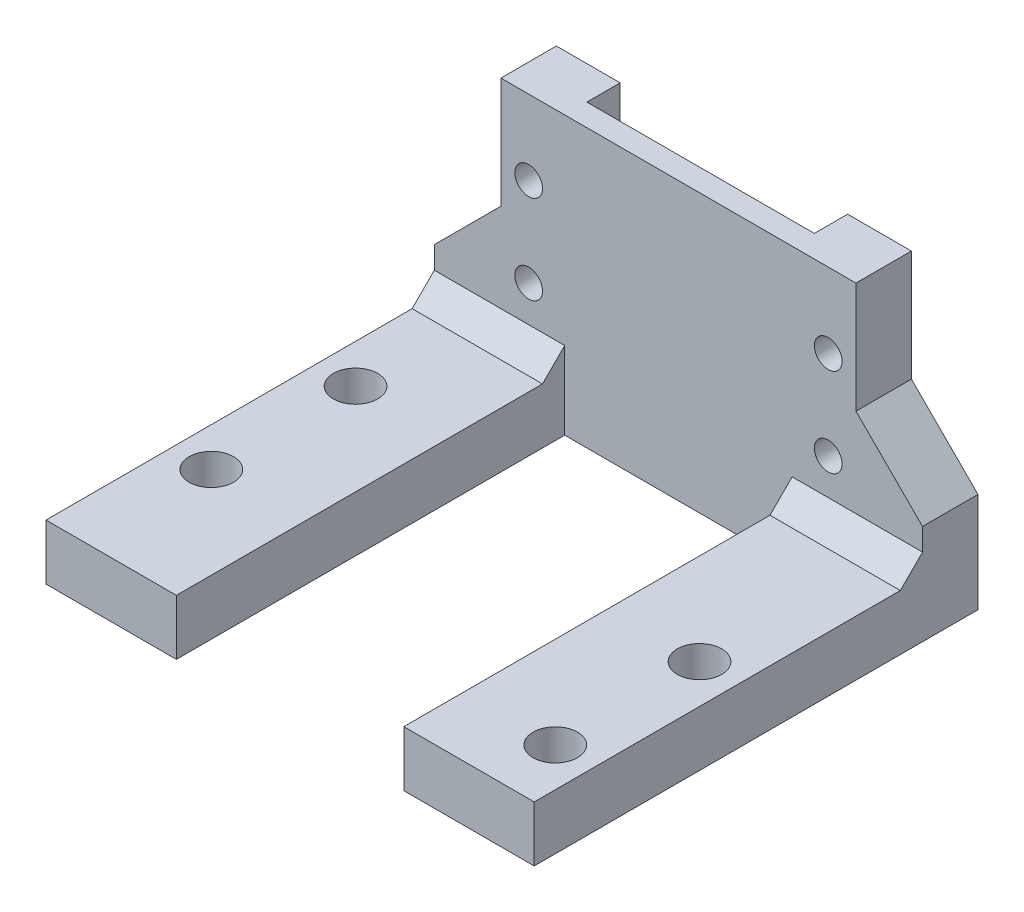
from build123d import *

# Parameters (mm, degrees)
SZKIC1_W                    = 32
SZKIC1_H                    = 25
DODANIE_WYCI_GNI_CIE1_DEPTH = 2
SZKIC2_W                    = 5.75
SZKIC2_H                    = 25
DODANIE_WYCI_GNI_CIE2_DEPTH = 3
SZKIC4_W                    = 11.75
SZKIC4_H                    = 5
SZKIC4_W_2                  = 6
SZKIC4_W_3                  = 5.75
DODANIE_WYCI_GNI_CIE3_DEPTH = 40
SZKIC5_R                    = 1.25
WYTNIJ_WYCI_GNI_CIE1_DEPTH  = 35
SZKIC7_R                    = 2
WYTNIJ_WYCI_GNI_CIE2_DEPTH  = 35
SFAZOWANIE1_SIZE            = 10
SFAZOWANIE2_SIZE            = 2


with BuildPart() as part:
    # Szkic1 → Dodanie-wyciągnięcie1 (new body)
    with BuildSketch(Plane.XY):
        Rectangle(SZKIC1_W, SZKIC1_H)
    extrude(amount=DODANIE_WYCI_GNI_CIE1_DEPTH)

    # Szkic2 → Dodanie-wyciągnięcie2 (add)
    with BuildSketch(Plane(origin=(0, 0, 0), x_dir=(-1, 0, 0), z_dir=(0, 0, -1))):
        with Locations((-13.125, 0)):
            Rectangle(SZKIC2_W, SZKIC2_H)
        with Locations((13.125, 0)):
            Rectangle(SZKIC2_W, SZKIC2_H)
    extrude(amount=DODANIE_WYCI_GNI_CIE2_DEPTH)

    # Szkic4 → Dodanie-wyciągnięcie3 (add)
    with BuildSketch(Plane(origin=(0, 0, -3), x_dir=(-1, 0, 0), z_dir=(0, 0, -1))):
        with Locations((-16.125, -10)):
            Rectangle(SZKIC4_W, SZKIC4_H)
        with Locations((19, -10)):
            Rectangle(SZKIC4_W_2, SZKIC4_H)
        with Locations((13.125, -10)):
            Rectangle(SZKIC4_W_3, SZKIC4_H)
    extrude(amount=-DODANIE_WYCI_GNI_CIE3_DEPTH)

    # Szkic5 → Wytnij-wyciągnięcie1 (cut)
    with BuildSketch(Plane.XY.offset(2)):
        with Locations((-13.5, 5.75)):
            Circle(SZKIC5_R)
        with Locations((-13.5, -2.25)):
            Circle(SZKIC5_R)
        with Locations((13.5, -2.25)):
            Circle(SZKIC5_R)
        with Locations((13.5, 5.75)):
            Circle(SZKIC5_R)
    extrude(amount=-WYTNIJ_WYCI_GNI_CIE1_DEPTH, mode=Mode.SUBTRACT)

    # Szkic7 → Wytnij-wyciągnięcie2 (cut)
    with BuildSketch(Plane(origin=(0, -7.5, 0), x_dir=(1, 0, 0), z_dir=(0, 1, 0))):
        with Locations(Location((18.5, -31.6, 0), (0, 0, 180))):
            Circle(SZKIC7_R)
        with Locations(Location((18.5, -18.6, 0), (0, 0, 180))):
            Circle(SZKIC7_R)
        with Locations(Location((-18.5, -25.6, 0), (0, 0, 180))):
            Circle(SZKIC7_R)
        with Locations(Location((-18.5, -12.6, 0), (0, 0, 180))):
            Circle(SZKIC7_R)
    extrude(amount=-WYTNIJ_WYCI_GNI_CIE2_DEPTH, mode=Mode.SUBTRACT)

    # Sfazowanie1
    # the kernel refuses this chamfer: 10 mm, written as the material it adds along each edge
    with BuildSketch(Plane(origin=(16, -7.5, -3), x_dir=(0.9996219169112968, -0.027495876610586317, 0), z_dir=(0, 0, 1))) as sfazowanie1_piece_1_section:
        Polygon((SFAZOWANIE1_SIZE * 0.999621916911, SFAZOWANIE1_SIZE * 0.0274958766106), (-SFAZOWANIE1_SIZE * 0.0274958766106, SFAZOWANIE1_SIZE * 0.999621916911), (0, 0), align=None)
    sfazowanie1_piece_1 = extrude(amount=5, mode=Mode.PRIVATE)
    sfazowanie1_piece_1 = split(sfazowanie1_piece_1, bisect_by=Plane(origin=(22, -3.749905405, -0.5), z_dir=(-1, 0, 0)), keep=Keep.TOP, mode=Mode.PRIVATE)
    add(sfazowanie1_piece_1)
    with BuildSketch(Plane(origin=(-16, -7.5, 2), x_dir=(-0.9996219169112968, -0.027495876610586403, 0), z_dir=(0, 0, -1))) as sfazowanie1_piece_2_section:
        Polygon((SFAZOWANIE1_SIZE * 0.999621916911, SFAZOWANIE1_SIZE * 0.0274958766106), (-SFAZOWANIE1_SIZE * 0.0274958766106, SFAZOWANIE1_SIZE * 0.999621916911), (0, 0), align=None)
    sfazowanie1_piece_2 = extrude(amount=5, mode=Mode.PRIVATE)
    sfazowanie1_piece_2 = split(sfazowanie1_piece_2, bisect_by=Plane(origin=(-22, -3.749905405, -0.5), z_dir=(1, 0, 0)), keep=Keep.TOP, mode=Mode.PRIVATE)
    add(sfazowanie1_piece_2)

    # Sfazowanie2
    sfazowanie2_edges = [part.edges().sort_by_distance(p)[0] for p in [
        (16.125, -7.5, 2),
        (-16.125, -7.5, 2),
    ]]
    chamfer(sfazowanie2_edges, length=SFAZOWANIE2_SIZE)


solid = part.part
